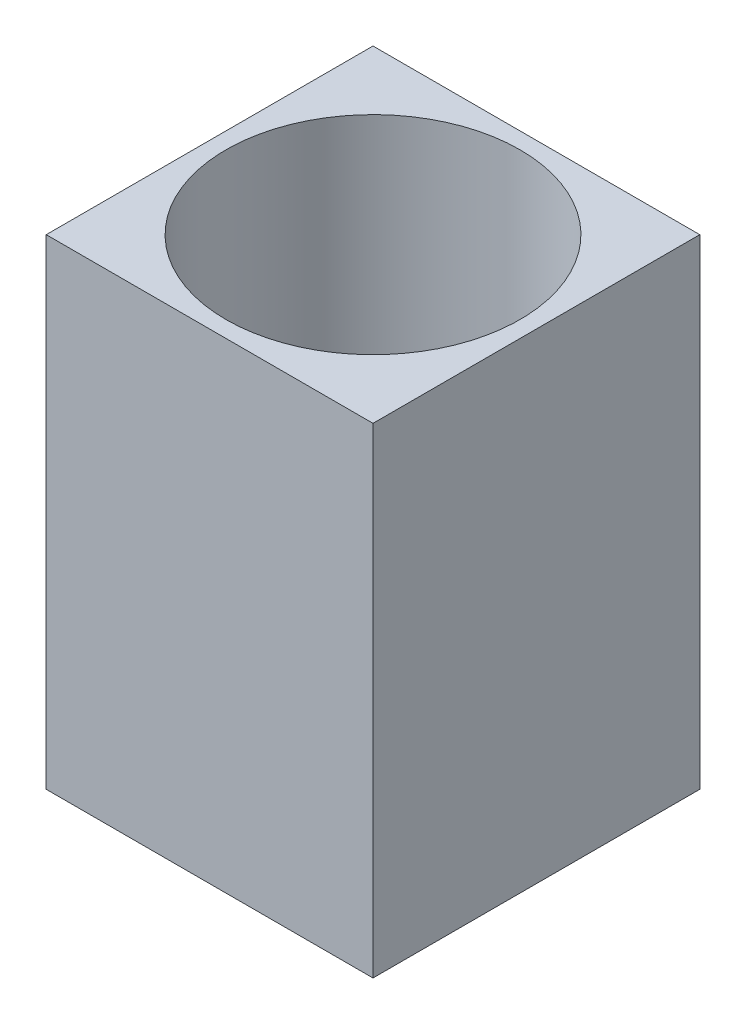
from build123d import *

# Parameters (mm, degrees)
SKETCH1_W           = 10
SKETCH1_H           = 10
SKETCH1_R           = 4.5
BOSS_EXTRUDE1_DEPTH = 14.7


with BuildPart() as part:
    # Sketch1 → Boss-Extrude1 (new body)
    with BuildSketch(Plane(origin=(0, 0, 0), x_dir=(1, 0, 0), z_dir=(0, 1, 0))):
        with Locations((5, -5)):
            Rectangle(SKETCH1_W, SKETCH1_H)
        with Locations((5, -5)):
            Circle(SKETCH1_R, mode=Mode.SUBTRACT)
    extrude(amount=BOSS_EXTRUDE1_DEPTH)


solid = part.part
